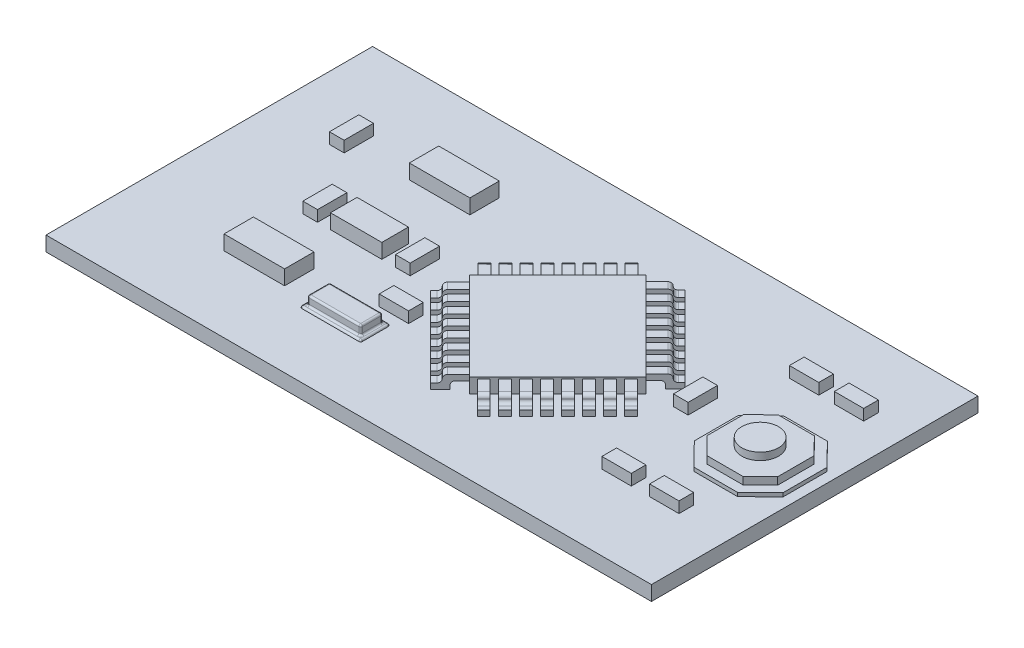
from build123d import *

# Parameters (mm, degrees)
BOARD_DIMENSIONS_W     = 33
BOARD_DIMENSIONS_H     = 17.8
BOARD_DEPTH            = 0.8
COMPONENTS1_W          = 3.3
COMPONENTS1_H          = 1.6
COMPONENTS1_W_2        = 2.8
COMPONENTS1_H_2        = 1.45
LARGE_COMPONENTS_DEPTH = 0.8
SKETCH7_W              = 0.8
SKETCH7_H              = 1.6
SKETCH7_W_2            = 1.6
SKETCH7_H_2            = 0.8
SMALL_COMPONENTS_DEPTH = 0.6
SKETCH8_W              = 3.3
SKETCH8_H              = 1.6
CRYSTAL_BOTTOM_DEPTH   = 0.1
SKETCH9_W              = 2.9
SKETCH9_H              = 1.2
CRYSTAL_TOP_DEPTH      = 0.5
FILLET_2_R             = 0.1
ATMEL_DEPTH            = 0.8
BOSS_EXTRUDE8_DEPTH    = 0.5
FILLET7_R              = 0.2
LPATTERN4_COUNT        = 8
LPATTERN4_PITCH        = 0.81
FILLET7_OF_LPATTERN4_R = 0.2
MIRROR8_START          = 4.131544437
MIRROR8_DEPTH          = 0.5
MIRROR8_START_2        = 4.941544437
MIRROR8_2_DEPTH        = 0.5
MIRROR8_START_3        = 5.751544437
MIRROR8_3_DEPTH        = 0.5
MIRROR8_START_4        = 6.561544437
MIRROR8_4_DEPTH        = 0.5
MIRROR8_START_5        = 7.371544437
MIRROR8_5_DEPTH        = 0.5
MIRROR8_START_6        = 8.181544437
MIRROR8_6_DEPTH        = 0.5
MIRROR8_START_7        = 8.991544437
MIRROR8_7_DEPTH        = 0.5
MIRROR8_START_8        = 9.801544437
MIRROR8_8_DEPTH        = 0.5
BOSS_EXTRUDE9_START    = 16.65192446
BOSS_EXTRUDE9_DEPTH    = 0.5
BOSS_EXTRUDE9_START_2  = 17.46192446
BOSS_EXTRUDE9_2_DEPTH  = 0.5
BOSS_EXTRUDE9_START_3  = 18.27192446
BOSS_EXTRUDE9_3_DEPTH  = 0.5
BOSS_EXTRUDE9_START_4  = 19.08192446
BOSS_EXTRUDE9_4_DEPTH  = 0.5
BOSS_EXTRUDE9_START_5  = 19.89192446
BOSS_EXTRUDE9_5_DEPTH  = 0.5
BOSS_EXTRUDE9_START_6  = 20.70192446
BOSS_EXTRUDE9_6_DEPTH  = 0.5
BOSS_EXTRUDE9_START_7  = 21.51192446
BOSS_EXTRUDE9_7_DEPTH  = 0.5
BOSS_EXTRUDE9_START_8  = 22.32192446
BOSS_EXTRUDE9_8_DEPTH  = 0.5
BOSS_EXTRUDE9_START_9  = 4.101544437
BOSS_EXTRUDE9_9_DEPTH  = 0.5
BOSS_EXTRUDE9_START_10 = 4.911544437
BOSS_EXTRUDE9_10_DEPTH = 0.5
BOSS_EXTRUDE9_START_11 = 5.721544437
BOSS_EXTRUDE9_11_DEPTH = 0.5
BOSS_EXTRUDE9_START_12 = 6.531544437
BOSS_EXTRUDE9_12_DEPTH = 0.5
BOSS_EXTRUDE9_START_13 = 7.341544437
BOSS_EXTRUDE9_13_DEPTH = 0.5
BOSS_EXTRUDE9_START_14 = 8.151544437
BOSS_EXTRUDE9_14_DEPTH = 0.5
BOSS_EXTRUDE9_START_15 = 8.961544437
BOSS_EXTRUDE9_15_DEPTH = 0.5
BOSS_EXTRUDE9_START_16 = 9.771544437
BOSS_EXTRUDE9_16_DEPTH = 0.5
BOSS_EXTRUDE9_START_17 = 0.8
BOSS_EXTRUDE9_17_DEPTH = 0.2
BOSS_EXTRUDE10_DEPTH   = 0.4
SKETCH24_R             = 1
BOSS_EXTRUDE11_DEPTH   = 0.4


# Read off the part's stored shape, not the designer's step: Mirror8, Boss-Extrude9
with BuildPart() as part:
    # Board_dimensions → Board (new body)
    with BuildSketch(Plane(origin=(0, 0, 0), x_dir=(1, 0, 0), z_dir=(0, 1, 0))):
        with Locations((16.5, 8.9)):
            Rectangle(BOARD_DIMENSIONS_W, BOARD_DIMENSIONS_H)
    extrude(amount=BOARD_DEPTH)

    # Components1 → Large Components (add)
    with BuildSketch(Plane(origin=(0, 0.8, 0), x_dir=(1, 0, 0), z_dir=(0, 1, 0))):
        with Locations((8.95, 13.304486799)):
            Rectangle(COMPONENTS1_W, COMPONENTS1_H)
        with Locations((7.25, 4.904486799)):
            Rectangle(COMPONENTS1_W, COMPONENTS1_H)
        with Locations((8.9, 8.729486799)):
            Rectangle(COMPONENTS1_W_2, COMPONENTS1_H_2)
    extrude(amount=LARGE_COMPONENTS_DEPTH)

    # Sketch7 → Small Components (add)
    with BuildSketch(Plane(origin=(0, 0.8, 0), x_dir=(1, 0, 0), z_dir=(0, 1, 0))):
        with Locations((6.4, 8.8)):
            Rectangle(SKETCH7_W, SKETCH7_H)
        with Locations((11.45, 8.8)):
            Rectangle(SKETCH7_W, SKETCH7_H)
        with Locations((13.261761712, 6.1)):
            Rectangle(SKETCH7_W_2, SKETCH7_H_2)
        with Locations((27, 4.5)):
            Rectangle(SKETCH7_W_2, SKETCH7_H_2)
        with Locations((3.85, 12.8)):
            Rectangle(SKETCH7_W, SKETCH7_H)
        with Locations((29.6, 4.5)):
            Rectangle(SKETCH7_W_2, SKETCH7_H_2)
        with Locations((27.8201209, 13.9)):
            Rectangle(SKETCH7_W_2, SKETCH7_H_2)
        with Locations((30.2701209, 13.9)):
            Rectangle(SKETCH7_W_2, SKETCH7_H_2)
        with Locations((25.6, 9.8)):
            Rectangle(SKETCH7_W, SKETCH7_H)
    extrude(amount=SMALL_COMPONENTS_DEPTH)

    # Sketch8 → Crystal_bottom (add)
    with BuildSketch(Plane(origin=(0, 0.8, 0), x_dir=(1, 0, 0), z_dir=(0, 1, 0))):
        with Locations((12, 4.3)):
            Rectangle(SKETCH8_W, SKETCH8_H)
    extrude(amount=CRYSTAL_BOTTOM_DEPTH)

    # Sketch9 → Crystal_top (add)
    with BuildSketch(Plane(origin=(0, 0.9, 0), x_dir=(1, 0, 0), z_dir=(0, 1, 0))):
        with Locations((12, 4.3)):
            Rectangle(SKETCH9_W, SKETCH9_H)
    extrude(amount=CRYSTAL_TOP_DEPTH)

    # Fillet 2
    fillet_2_edges = [part.edges().sort_by_distance(p)[0] for p in [
        (10.35, 0.85, -5.1),
        (10.35, 0.85, -3.5),
        (13.65, 0.85, -3.5),
        (13.65, 0.85, -5.1),
        (10.35, 0.9, -4.3),
        (12, 0.9, -3.5),
        (13.65, 0.9, -4.3),
        (12, 0.9, -5.1),
        (10.55, 0.9, -4.3),
        (10.55, 1.15, -4.9),
        (12, 0.9, -3.7),
        (10.55, 1.15, -3.7),
        (13.45, 0.9, -4.3),
        (13.45, 1.15, -3.7),
        (12, 0.9, -4.9),
        (13.45, 1.15, -4.9),
        (10.55, 1.4, -4.3),
        (12, 1.4, -3.7),
        (13.45, 1.4, -4.3),
        (12, 1.4, -4.9),
    ]]
    fillet(fillet_2_edges, radius=FILLET_2_R - 0.0001)  # a hair under: the kernel refuses the full size

    # Sketch10 → Atmel (add)
    with BuildSketch(Plane(origin=(0, 0.8, 0), x_dir=(1, 0, 0), z_dir=(0, 1, 0))):
        Polygon((19.03776743, 13.66157173), (23.846093542, 8.853245618), (19.03776743, 4.044919506), (14.229441318, 8.853245618), align=None)
    extrude(amount=ATMEL_DEPTH)

    # Sketch13 → Boss-Extrude8 (add)
    with BuildSketch(Plane(origin=(11.753475502, 0, -11.753475502), x_dir=(0.707106781186544, 0, 0.7071067811865511), z_dir=(-0.7071067811865511, 0, 0.707106781186544))):
        Polygon((11.651544437, 1.5), (10.601544437, 1.5), (10.601544437, 1.2), (11.351544437, 1.2), (11.351544437, 0.8), (12.101544437, 0.8), (12.101544437, 1.1), (11.651544437, 1.1), align=None)
    boss_extrude8 = extrude(amount=-BOSS_EXTRUDE8_DEPTH)

    # Fillet7
    fillet7_edges = [part.edges().sort_by_distance(p)[0] for p in [
        (19.957006246, 1.2, -3.903498149),
        (20.16913828, 1.1, -3.691366115),
        (20.16913828, 1.5, -3.691366115),
    ]]
    fillet(fillet7_edges, radius=FILLET7_R - 0.0001)  # a hair under: the kernel refuses the full size

    # LPattern4: Boss-Extrude8 ×8
    with Locations(*[Vector(0.7071067811865515, 0, -0.7071067811865437) * (i * LPATTERN4_PITCH) for i in range(1, LPATTERN4_COUNT)]):
        add(boss_extrude8)

    # Fillet7 of LPattern4
    fillet7_of_lpattern4_edges = [part.edges().sort_by_distance(p)[0] for p in [
        (20.529762739, 1.2, -4.476254642),
        (20.741894773, 1.1, -4.264122608),
        (20.741894773, 1.5, -4.264122608),
        (21.102519231, 1.2, -5.049011135),
        (21.314651266, 1.1, -4.8368791),
        (21.314651266, 1.5, -4.8368791),
        (21.675275724, 1.2, -5.621767628),
        (21.887407759, 1.1, -5.409635593),
        (21.887407759, 1.5, -5.409635593),
        (22.248032217, 1.2, -6.19452412),
        (22.460164251, 1.1, -5.982392086),
        (22.460164251, 1.5, -5.982392086),
        (22.82078871, 1.2, -6.767280613),
        (23.032920744, 1.1, -6.555148579),
        (23.032920744, 1.5, -6.555148579),
        (23.393545203, 1.2, -7.340037106),
        (23.605677237, 1.1, -7.127905071),
        (23.605677237, 1.5, -7.127905071),
        (23.966301695, 1.2, -7.912793599),
        (24.17843373, 1.1, -7.700661564),
        (24.17843373, 1.5, -7.700661564),
    ]]
    fillet(fillet7_of_lpattern4_edges, radius=FILLET7_OF_LPATTERN4_R - 0.0001)  # a hair under: the kernel refuses the full size

    # Mirror8 outline → Mirror8 (add)
    with BuildSketch(Plane(origin=(0, 0, 0), x_dir=(0.7071067811865509, 0, -0.707106781186544), z_dir=(0.707106781186544, 0, 0.707106781186551)).offset(MIRROR8_START)):
        with BuildLine():
            Line((16.32192446, 1.5), (15.47192446, 1.5))
            ThreePointArc((15.47192446, 1.5), (15.330503104, 1.441421356), (15.27192446, 1.3))
            ThreePointArc((15.27192446, 1.3), (15.213345817, 1.158578643), (15.07192446, 1.1))
            Line((15.07192446, 1.1), (14.82192446, 1.1))
            Line((14.82192446, 1.1), (14.82192446, 0.8))
            Line((14.82192446, 0.8), (15.57192446, 0.8))
            Line((15.57192446, 0.8), (15.57192446, 1))
            ThreePointArc((15.57192446, 1), (15.630503104, 1.141421356), (15.77192446, 1.2))
            Line((15.77192446, 1.2), (16.32192446, 1.2))
            Line((16.32192446, 1.2), (16.32192446, 1.5))
        make_face()
    extrude(amount=MIRROR8_DEPTH)

    # Mirror8 2 outline → Mirror8 2 (add)
    with BuildSketch(Plane(origin=(0, 0, 0), x_dir=(0.7071067811865509, 0, -0.707106781186544), z_dir=(0.707106781186544, 0, 0.707106781186551)).offset(MIRROR8_START_2)):
        with BuildLine():
            Line((16.32192446, 1.5), (15.47192446, 1.5))
            ThreePointArc((15.47192446, 1.5), (15.330503104, 1.441421356), (15.27192446, 1.3))
            ThreePointArc((15.27192446, 1.3), (15.213345817, 1.158578643), (15.07192446, 1.1))
            Line((15.07192446, 1.1), (14.82192446, 1.1))
            Line((14.82192446, 1.1), (14.82192446, 0.8))
            Line((14.82192446, 0.8), (15.57192446, 0.8))
            Line((15.57192446, 0.8), (15.57192446, 1))
            ThreePointArc((15.57192446, 1), (15.630503104, 1.141421356), (15.77192446, 1.2))
            Line((15.77192446, 1.2), (16.32192446, 1.2))
            Line((16.32192446, 1.2), (16.32192446, 1.5))
        make_face()
    extrude(amount=MIRROR8_2_DEPTH)

    # Mirror8 3 outline → Mirror8 3 (add)
    with BuildSketch(Plane(origin=(0, 0, 0), x_dir=(0.7071067811865509, 0, -0.707106781186544), z_dir=(0.707106781186544, 0, 0.707106781186551)).offset(MIRROR8_START_3)):
        with BuildLine():
            Line((16.32192446, 1.5), (15.47192446, 1.5))
            ThreePointArc((15.47192446, 1.5), (15.330503104, 1.441421356), (15.27192446, 1.3))
            ThreePointArc((15.27192446, 1.3), (15.213345817, 1.158578643), (15.07192446, 1.1))
            Line((15.07192446, 1.1), (14.82192446, 1.1))
            Line((14.82192446, 1.1), (14.82192446, 0.8))
            Line((14.82192446, 0.8), (15.57192446, 0.8))
            Line((15.57192446, 0.8), (15.57192446, 1))
            ThreePointArc((15.57192446, 1), (15.630503104, 1.141421356), (15.77192446, 1.2))
            Line((15.77192446, 1.2), (16.32192446, 1.2))
            Line((16.32192446, 1.2), (16.32192446, 1.5))
        make_face()
    extrude(amount=MIRROR8_3_DEPTH)

    # Mirror8 4 outline → Mirror8 4 (add)
    with BuildSketch(Plane(origin=(0, 0, 0), x_dir=(0.7071067811865509, 0, -0.707106781186544), z_dir=(0.707106781186544, 0, 0.707106781186551)).offset(MIRROR8_START_4)):
        with BuildLine():
            Line((16.32192446, 1.5), (15.47192446, 1.5))
            ThreePointArc((15.47192446, 1.5), (15.330503104, 1.441421356), (15.27192446, 1.3))
            ThreePointArc((15.27192446, 1.3), (15.213345817, 1.158578643), (15.07192446, 1.1))
            Line((15.07192446, 1.1), (14.82192446, 1.1))
            Line((14.82192446, 1.1), (14.82192446, 0.8))
            Line((14.82192446, 0.8), (15.57192446, 0.8))
            Line((15.57192446, 0.8), (15.57192446, 1))
            ThreePointArc((15.57192446, 1), (15.630503104, 1.141421356), (15.77192446, 1.2))
            Line((15.77192446, 1.2), (16.32192446, 1.2))
            Line((16.32192446, 1.2), (16.32192446, 1.5))
        make_face()
    extrude(amount=MIRROR8_4_DEPTH)

    # Mirror8 5 outline → Mirror8 5 (add)
    with BuildSketch(Plane(origin=(0, 0, 0), x_dir=(0.7071067811865509, 0, -0.707106781186544), z_dir=(0.707106781186544, 0, 0.707106781186551)).offset(MIRROR8_START_5)):
        with BuildLine():
            Line((16.32192446, 1.5), (15.47192446, 1.5))
            ThreePointArc((15.47192446, 1.5), (15.330503104, 1.441421356), (15.27192446, 1.3))
            ThreePointArc((15.27192446, 1.3), (15.213345817, 1.158578643), (15.07192446, 1.1))
            Line((15.07192446, 1.1), (14.82192446, 1.1))
            Line((14.82192446, 1.1), (14.82192446, 0.8))
            Line((14.82192446, 0.8), (15.57192446, 0.8))
            Line((15.57192446, 0.8), (15.57192446, 1))
            ThreePointArc((15.57192446, 1), (15.630503104, 1.141421356), (15.77192446, 1.2))
            Line((15.77192446, 1.2), (16.32192446, 1.2))
            Line((16.32192446, 1.2), (16.32192446, 1.5))
        make_face()
    extrude(amount=MIRROR8_5_DEPTH)

    # Mirror8 6 outline → Mirror8 6 (add)
    with BuildSketch(Plane(origin=(0, 0, 0), x_dir=(0.7071067811865509, 0, -0.707106781186544), z_dir=(0.707106781186544, 0, 0.707106781186551)).offset(MIRROR8_START_6)):
        with BuildLine():
            Line((16.32192446, 1.5), (15.47192446, 1.5))
            ThreePointArc((15.47192446, 1.5), (15.330503104, 1.441421356), (15.27192446, 1.3))
            ThreePointArc((15.27192446, 1.3), (15.213345817, 1.158578643), (15.07192446, 1.1))
            Line((15.07192446, 1.1), (14.82192446, 1.1))
            Line((14.82192446, 1.1), (14.82192446, 0.8))
            Line((14.82192446, 0.8), (15.57192446, 0.8))
            Line((15.57192446, 0.8), (15.57192446, 1))
            ThreePointArc((15.57192446, 1), (15.630503104, 1.141421356), (15.77192446, 1.2))
            Line((15.77192446, 1.2), (16.32192446, 1.2))
            Line((16.32192446, 1.2), (16.32192446, 1.5))
        make_face()
    extrude(amount=MIRROR8_6_DEPTH)

    # Mirror8 7 outline → Mirror8 7 (add)
    with BuildSketch(Plane(origin=(0, 0, 0), x_dir=(0.7071067811865509, 0, -0.707106781186544), z_dir=(0.707106781186544, 0, 0.707106781186551)).offset(MIRROR8_START_7)):
        with BuildLine():
            Line((16.32192446, 1.5), (15.47192446, 1.5))
            ThreePointArc((15.47192446, 1.5), (15.330503104, 1.441421356), (15.27192446, 1.3))
            ThreePointArc((15.27192446, 1.3), (15.213345817, 1.158578643), (15.07192446, 1.1))
            Line((15.07192446, 1.1), (14.82192446, 1.1))
            Line((14.82192446, 1.1), (14.82192446, 0.8))
            Line((14.82192446, 0.8), (15.57192446, 0.8))
            Line((15.57192446, 0.8), (15.57192446, 1))
            ThreePointArc((15.57192446, 1), (15.630503104, 1.141421356), (15.77192446, 1.2))
            Line((15.77192446, 1.2), (16.32192446, 1.2))
            Line((16.32192446, 1.2), (16.32192446, 1.5))
        make_face()
    extrude(amount=MIRROR8_7_DEPTH)

    # Mirror8 8 outline → Mirror8 8 (add)
    with BuildSketch(Plane(origin=(0, 0, 0), x_dir=(0.7071067811865509, 0, -0.707106781186544), z_dir=(0.707106781186544, 0, 0.707106781186551)).offset(MIRROR8_START_8)):
        with BuildLine():
            Line((16.32192446, 1.5), (15.47192446, 1.5))
            ThreePointArc((15.47192446, 1.5), (15.330503104, 1.441421356), (15.27192446, 1.3))
            ThreePointArc((15.27192446, 1.3), (15.213345817, 1.158578643), (15.07192446, 1.1))
            Line((15.07192446, 1.1), (14.82192446, 1.1))
            Line((14.82192446, 1.1), (14.82192446, 0.8))
            Line((14.82192446, 0.8), (15.57192446, 0.8))
            Line((15.57192446, 0.8), (15.57192446, 1))
            ThreePointArc((15.57192446, 1), (15.630503104, 1.141421356), (15.77192446, 1.2))
            Line((15.77192446, 1.2), (16.32192446, 1.2))
            Line((16.32192446, 1.2), (16.32192446, 1.5))
        make_face()
    extrude(amount=MIRROR8_8_DEPTH)

    # Boss-Extrude9 outline → Boss-Extrude9 (add)
    with BuildSketch(Plane(origin=(0, 0, 0), x_dir=(0.7071067811865438, 0, 0.7071067811865512), z_dir=(0.7071067811865511, 0, -0.7071067811865441)).offset(BOSS_EXTRUDE9_START)):
        with BuildLine():
            ThreePointArc((2.751544437, -1.3), (2.810123081, -1.441421356), (2.951544437, -1.5))
            Line((2.951544437, -1.5), (3.801544437, -1.5))
            Line((3.801544437, -1.5), (3.801544437, -1.2))
            Line((3.801544437, -1.2), (3.251544437, -1.2))
            ThreePointArc((3.251544437, -1.2), (3.110123081, -1.141421356), (3.051544437, -1))
            Line((3.051544437, -1), (3.051544437, -0.8))
            Line((3.051544437, -0.8), (2.301544437, -0.8))
            Line((2.301544437, -0.8), (2.301544437, -1.1))
            Line((2.301544437, -1.1), (2.551544437, -1.1))
            ThreePointArc((2.551544437, -1.1), (2.692965793, -1.158578644), (2.751544437, -1.3))
        make_face()
    extrude(amount=BOSS_EXTRUDE9_DEPTH)

    # Boss-Extrude9 2 outline → Boss-Extrude9 2 (add)
    with BuildSketch(Plane(origin=(0, 0, 0), x_dir=(0.7071067811865438, 0, 0.7071067811865512), z_dir=(0.7071067811865511, 0, -0.7071067811865441)).offset(BOSS_EXTRUDE9_START_2)):
        with BuildLine():
            ThreePointArc((2.751544437, -1.3), (2.810123081, -1.441421356), (2.951544437, -1.5))
            Line((2.951544437, -1.5), (3.801544437, -1.5))
            Line((3.801544437, -1.5), (3.801544437, -1.2))
            Line((3.801544437, -1.2), (3.251544437, -1.2))
            ThreePointArc((3.251544437, -1.2), (3.110123081, -1.141421356), (3.051544437, -1))
            Line((3.051544437, -1), (3.051544437, -0.8))
            Line((3.051544437, -0.8), (2.301544437, -0.8))
            Line((2.301544437, -0.8), (2.301544437, -1.1))
            Line((2.301544437, -1.1), (2.551544437, -1.1))
            ThreePointArc((2.551544437, -1.1), (2.692965793, -1.158578644), (2.751544437, -1.3))
        make_face()
    extrude(amount=BOSS_EXTRUDE9_2_DEPTH)

    # Boss-Extrude9 3 outline → Boss-Extrude9 3 (add)
    with BuildSketch(Plane(origin=(0, 0, 0), x_dir=(0.7071067811865438, 0, 0.7071067811865512), z_dir=(0.7071067811865511, 0, -0.7071067811865441)).offset(BOSS_EXTRUDE9_START_3)):
        with BuildLine():
            ThreePointArc((2.751544437, -1.3), (2.810123081, -1.441421356), (2.951544437, -1.5))
            Line((2.951544437, -1.5), (3.801544437, -1.5))
            Line((3.801544437, -1.5), (3.801544437, -1.2))
            Line((3.801544437, -1.2), (3.251544437, -1.2))
            ThreePointArc((3.251544437, -1.2), (3.110123081, -1.141421356), (3.051544437, -1))
            Line((3.051544437, -1), (3.051544437, -0.8))
            Line((3.051544437, -0.8), (2.301544437, -0.8))
            Line((2.301544437, -0.8), (2.301544437, -1.1))
            Line((2.301544437, -1.1), (2.551544437, -1.1))
            ThreePointArc((2.551544437, -1.1), (2.692965793, -1.158578644), (2.751544437, -1.3))
        make_face()
    extrude(amount=BOSS_EXTRUDE9_3_DEPTH)

    # Boss-Extrude9 4 outline → Boss-Extrude9 4 (add)
    with BuildSketch(Plane(origin=(0, 0, 0), x_dir=(0.7071067811865438, 0, 0.7071067811865512), z_dir=(0.7071067811865511, 0, -0.7071067811865441)).offset(BOSS_EXTRUDE9_START_4)):
        with BuildLine():
            ThreePointArc((2.751544437, -1.3), (2.810123081, -1.441421356), (2.951544437, -1.5))
            Line((2.951544437, -1.5), (3.801544437, -1.5))
            Line((3.801544437, -1.5), (3.801544437, -1.2))
            Line((3.801544437, -1.2), (3.251544437, -1.2))
            ThreePointArc((3.251544437, -1.2), (3.110123081, -1.141421356), (3.051544437, -1))
            Line((3.051544437, -1), (3.051544437, -0.8))
            Line((3.051544437, -0.8), (2.301544437, -0.8))
            Line((2.301544437, -0.8), (2.301544437, -1.1))
            Line((2.301544437, -1.1), (2.551544437, -1.1))
            ThreePointArc((2.551544437, -1.1), (2.692965793, -1.158578644), (2.751544437, -1.3))
        make_face()
    extrude(amount=BOSS_EXTRUDE9_4_DEPTH)

    # Boss-Extrude9 5 outline → Boss-Extrude9 5 (add)
    with BuildSketch(Plane(origin=(0, 0, 0), x_dir=(0.7071067811865438, 0, 0.7071067811865512), z_dir=(0.7071067811865511, 0, -0.7071067811865441)).offset(BOSS_EXTRUDE9_START_5)):
        with BuildLine():
            ThreePointArc((2.751544437, -1.3), (2.810123081, -1.441421356), (2.951544437, -1.5))
            Line((2.951544437, -1.5), (3.801544437, -1.5))
            Line((3.801544437, -1.5), (3.801544437, -1.2))
            Line((3.801544437, -1.2), (3.251544437, -1.2))
            ThreePointArc((3.251544437, -1.2), (3.110123081, -1.141421356), (3.051544437, -1))
            Line((3.051544437, -1), (3.051544437, -0.8))
            Line((3.051544437, -0.8), (2.301544437, -0.8))
            Line((2.301544437, -0.8), (2.301544437, -1.1))
            Line((2.301544437, -1.1), (2.551544437, -1.1))
            ThreePointArc((2.551544437, -1.1), (2.692965793, -1.158578644), (2.751544437, -1.3))
        make_face()
    extrude(amount=BOSS_EXTRUDE9_5_DEPTH)

    # Boss-Extrude9 6 outline → Boss-Extrude9 6 (add)
    with BuildSketch(Plane(origin=(0, 0, 0), x_dir=(0.7071067811865438, 0, 0.7071067811865512), z_dir=(0.7071067811865511, 0, -0.7071067811865441)).offset(BOSS_EXTRUDE9_START_6)):
        with BuildLine():
            ThreePointArc((2.751544437, -1.3), (2.810123081, -1.441421356), (2.951544437, -1.5))
            Line((2.951544437, -1.5), (3.801544437, -1.5))
            Line((3.801544437, -1.5), (3.801544437, -1.2))
            Line((3.801544437, -1.2), (3.251544437, -1.2))
            ThreePointArc((3.251544437, -1.2), (3.110123081, -1.141421356), (3.051544437, -1))
            Line((3.051544437, -1), (3.051544437, -0.8))
            Line((3.051544437, -0.8), (2.301544437, -0.8))
            Line((2.301544437, -0.8), (2.301544437, -1.1))
            Line((2.301544437, -1.1), (2.551544437, -1.1))
            ThreePointArc((2.551544437, -1.1), (2.692965793, -1.158578644), (2.751544437, -1.3))
        make_face()
    extrude(amount=BOSS_EXTRUDE9_6_DEPTH)

    # Boss-Extrude9 7 outline → Boss-Extrude9 7 (add)
    with BuildSketch(Plane(origin=(0, 0, 0), x_dir=(0.7071067811865438, 0, 0.7071067811865512), z_dir=(0.7071067811865511, 0, -0.7071067811865441)).offset(BOSS_EXTRUDE9_START_7)):
        with BuildLine():
            ThreePointArc((2.751544437, -1.3), (2.810123081, -1.441421356), (2.951544437, -1.5))
            Line((2.951544437, -1.5), (3.801544437, -1.5))
            Line((3.801544437, -1.5), (3.801544437, -1.2))
            Line((3.801544437, -1.2), (3.251544437, -1.2))
            ThreePointArc((3.251544437, -1.2), (3.110123081, -1.141421356), (3.051544437, -1))
            Line((3.051544437, -1), (3.051544437, -0.8))
            Line((3.051544437, -0.8), (2.301544437, -0.8))
            Line((2.301544437, -0.8), (2.301544437, -1.1))
            Line((2.301544437, -1.1), (2.551544437, -1.1))
            ThreePointArc((2.551544437, -1.1), (2.692965793, -1.158578644), (2.751544437, -1.3))
        make_face()
    extrude(amount=BOSS_EXTRUDE9_7_DEPTH)

    # Boss-Extrude9 8 outline → Boss-Extrude9 8 (add)
    with BuildSketch(Plane(origin=(0, 0, 0), x_dir=(0.7071067811865438, 0, 0.7071067811865512), z_dir=(0.7071067811865511, 0, -0.7071067811865441)).offset(BOSS_EXTRUDE9_START_8)):
        with BuildLine():
            ThreePointArc((2.751544437, -1.3), (2.810123081, -1.441421356), (2.951544437, -1.5))
            Line((2.951544437, -1.5), (3.801544437, -1.5))
            Line((3.801544437, -1.5), (3.801544437, -1.2))
            Line((3.801544437, -1.2), (3.251544437, -1.2))
            ThreePointArc((3.251544437, -1.2), (3.110123081, -1.141421356), (3.051544437, -1))
            Line((3.051544437, -1), (3.051544437, -0.8))
            Line((3.051544437, -0.8), (2.301544437, -0.8))
            Line((2.301544437, -0.8), (2.301544437, -1.1))
            Line((2.301544437, -1.1), (2.551544437, -1.1))
            ThreePointArc((2.551544437, -1.1), (2.692965793, -1.158578644), (2.751544437, -1.3))
        make_face()
    extrude(amount=BOSS_EXTRUDE9_8_DEPTH)

    # Boss-Extrude9 9 outline → Boss-Extrude9 9 (add)
    with BuildSketch(Plane(origin=(0, 0, 0), x_dir=(0.7071067811865509, 0, -0.707106781186544), z_dir=(0.707106781186544, 0, 0.707106781186551)).offset(BOSS_EXTRUDE9_START_9)):
        with BuildLine():
            Line((23.97192446, 1.5), (23.12192446, 1.5))
            Line((23.12192446, 1.5), (23.12192446, 1.2))
            Line((23.12192446, 1.2), (23.67192446, 1.2))
            ThreePointArc((23.67192446, 1.2), (23.813345817, 1.141421356), (23.87192446, 1))
            Line((23.87192446, 1), (23.87192446, 0.8))
            Line((23.87192446, 0.8), (24.62192446, 0.8))
            Line((24.62192446, 0.8), (24.62192446, 1.1))
            Line((24.62192446, 1.1), (24.37192446, 1.1))
            ThreePointArc((24.37192446, 1.1), (24.230503104, 1.158578644), (24.17192446, 1.3))
            ThreePointArc((24.17192446, 1.3), (24.113345817, 1.441421356), (23.97192446, 1.5))
        make_face()
    extrude(amount=BOSS_EXTRUDE9_9_DEPTH)

    # Boss-Extrude9 10 outline → Boss-Extrude9 10 (add)
    with BuildSketch(Plane(origin=(0, 0, 0), x_dir=(0.7071067811865509, 0, -0.707106781186544), z_dir=(0.707106781186544, 0, 0.707106781186551)).offset(BOSS_EXTRUDE9_START_10)):
        with BuildLine():
            Line((23.97192446, 1.5), (23.12192446, 1.5))
            Line((23.12192446, 1.5), (23.12192446, 1.2))
            Line((23.12192446, 1.2), (23.67192446, 1.2))
            ThreePointArc((23.67192446, 1.2), (23.813345817, 1.141421356), (23.87192446, 1))
            Line((23.87192446, 1), (23.87192446, 0.8))
            Line((23.87192446, 0.8), (24.62192446, 0.8))
            Line((24.62192446, 0.8), (24.62192446, 1.1))
            Line((24.62192446, 1.1), (24.37192446, 1.1))
            ThreePointArc((24.37192446, 1.1), (24.230503104, 1.158578644), (24.17192446, 1.3))
            ThreePointArc((24.17192446, 1.3), (24.113345817, 1.441421356), (23.97192446, 1.5))
        make_face()
    extrude(amount=BOSS_EXTRUDE9_10_DEPTH)

    # Boss-Extrude9 11 outline → Boss-Extrude9 11 (add)
    with BuildSketch(Plane(origin=(0, 0, 0), x_dir=(0.7071067811865509, 0, -0.707106781186544), z_dir=(0.707106781186544, 0, 0.707106781186551)).offset(BOSS_EXTRUDE9_START_11)):
        with BuildLine():
            Line((23.97192446, 1.5), (23.12192446, 1.5))
            Line((23.12192446, 1.5), (23.12192446, 1.2))
            Line((23.12192446, 1.2), (23.67192446, 1.2))
            ThreePointArc((23.67192446, 1.2), (23.813345817, 1.141421356), (23.87192446, 1))
            Line((23.87192446, 1), (23.87192446, 0.8))
            Line((23.87192446, 0.8), (24.62192446, 0.8))
            Line((24.62192446, 0.8), (24.62192446, 1.1))
            Line((24.62192446, 1.1), (24.37192446, 1.1))
            ThreePointArc((24.37192446, 1.1), (24.230503104, 1.158578644), (24.17192446, 1.3))
            ThreePointArc((24.17192446, 1.3), (24.113345817, 1.441421356), (23.97192446, 1.5))
        make_face()
    extrude(amount=BOSS_EXTRUDE9_11_DEPTH)

    # Boss-Extrude9 12 outline → Boss-Extrude9 12 (add)
    with BuildSketch(Plane(origin=(0, 0, 0), x_dir=(0.7071067811865509, 0, -0.707106781186544), z_dir=(0.707106781186544, 0, 0.707106781186551)).offset(BOSS_EXTRUDE9_START_12)):
        with BuildLine():
            Line((23.97192446, 1.5), (23.12192446, 1.5))
            Line((23.12192446, 1.5), (23.12192446, 1.2))
            Line((23.12192446, 1.2), (23.67192446, 1.2))
            ThreePointArc((23.67192446, 1.2), (23.813345817, 1.141421356), (23.87192446, 1))
            Line((23.87192446, 1), (23.87192446, 0.8))
            Line((23.87192446, 0.8), (24.62192446, 0.8))
            Line((24.62192446, 0.8), (24.62192446, 1.1))
            Line((24.62192446, 1.1), (24.37192446, 1.1))
            ThreePointArc((24.37192446, 1.1), (24.230503104, 1.158578644), (24.17192446, 1.3))
            ThreePointArc((24.17192446, 1.3), (24.113345817, 1.441421356), (23.97192446, 1.5))
        make_face()
    extrude(amount=BOSS_EXTRUDE9_12_DEPTH)

    # Boss-Extrude9 13 outline → Boss-Extrude9 13 (add)
    with BuildSketch(Plane(origin=(0, 0, 0), x_dir=(0.7071067811865509, 0, -0.707106781186544), z_dir=(0.707106781186544, 0, 0.707106781186551)).offset(BOSS_EXTRUDE9_START_13)):
        with BuildLine():
            Line((23.97192446, 1.5), (23.12192446, 1.5))
            Line((23.12192446, 1.5), (23.12192446, 1.2))
            Line((23.12192446, 1.2), (23.67192446, 1.2))
            ThreePointArc((23.67192446, 1.2), (23.813345817, 1.141421356), (23.87192446, 1))
            Line((23.87192446, 1), (23.87192446, 0.8))
            Line((23.87192446, 0.8), (24.62192446, 0.8))
            Line((24.62192446, 0.8), (24.62192446, 1.1))
            Line((24.62192446, 1.1), (24.37192446, 1.1))
            ThreePointArc((24.37192446, 1.1), (24.230503104, 1.158578644), (24.17192446, 1.3))
            ThreePointArc((24.17192446, 1.3), (24.113345817, 1.441421356), (23.97192446, 1.5))
        make_face()
    extrude(amount=BOSS_EXTRUDE9_13_DEPTH)

    # Boss-Extrude9 14 outline → Boss-Extrude9 14 (add)
    with BuildSketch(Plane(origin=(0, 0, 0), x_dir=(0.7071067811865509, 0, -0.707106781186544), z_dir=(0.707106781186544, 0, 0.707106781186551)).offset(BOSS_EXTRUDE9_START_14)):
        with BuildLine():
            Line((23.97192446, 1.5), (23.12192446, 1.5))
            Line((23.12192446, 1.5), (23.12192446, 1.2))
            Line((23.12192446, 1.2), (23.67192446, 1.2))
            ThreePointArc((23.67192446, 1.2), (23.813345817, 1.141421356), (23.87192446, 1))
            Line((23.87192446, 1), (23.87192446, 0.8))
            Line((23.87192446, 0.8), (24.62192446, 0.8))
            Line((24.62192446, 0.8), (24.62192446, 1.1))
            Line((24.62192446, 1.1), (24.37192446, 1.1))
            ThreePointArc((24.37192446, 1.1), (24.230503104, 1.158578644), (24.17192446, 1.3))
            ThreePointArc((24.17192446, 1.3), (24.113345817, 1.441421356), (23.97192446, 1.5))
        make_face()
    extrude(amount=BOSS_EXTRUDE9_14_DEPTH)

    # Boss-Extrude9 15 outline → Boss-Extrude9 15 (add)
    with BuildSketch(Plane(origin=(0, 0, 0), x_dir=(0.7071067811865509, 0, -0.707106781186544), z_dir=(0.707106781186544, 0, 0.707106781186551)).offset(BOSS_EXTRUDE9_START_15)):
        with BuildLine():
            Line((23.97192446, 1.5), (23.12192446, 1.5))
            Line((23.12192446, 1.5), (23.12192446, 1.2))
            Line((23.12192446, 1.2), (23.67192446, 1.2))
            ThreePointArc((23.67192446, 1.2), (23.813345817, 1.141421356), (23.87192446, 1))
            Line((23.87192446, 1), (23.87192446, 0.8))
            Line((23.87192446, 0.8), (24.62192446, 0.8))
            Line((24.62192446, 0.8), (24.62192446, 1.1))
            Line((24.62192446, 1.1), (24.37192446, 1.1))
            ThreePointArc((24.37192446, 1.1), (24.230503104, 1.158578644), (24.17192446, 1.3))
            ThreePointArc((24.17192446, 1.3), (24.113345817, 1.441421356), (23.97192446, 1.5))
        make_face()
    extrude(amount=BOSS_EXTRUDE9_15_DEPTH)

    # Boss-Extrude9 16 outline → Boss-Extrude9 16 (add)
    with BuildSketch(Plane(origin=(0, 0, 0), x_dir=(0.7071067811865509, 0, -0.707106781186544), z_dir=(0.707106781186544, 0, 0.707106781186551)).offset(BOSS_EXTRUDE9_START_16)):
        with BuildLine():
            Line((23.97192446, 1.5), (23.12192446, 1.5))
            Line((23.12192446, 1.5), (23.12192446, 1.2))
            Line((23.12192446, 1.2), (23.67192446, 1.2))
            ThreePointArc((23.67192446, 1.2), (23.813345817, 1.141421356), (23.87192446, 1))
            Line((23.87192446, 1), (23.87192446, 0.8))
            Line((23.87192446, 0.8), (24.62192446, 0.8))
            Line((24.62192446, 0.8), (24.62192446, 1.1))
            Line((24.62192446, 1.1), (24.37192446, 1.1))
            ThreePointArc((24.37192446, 1.1), (24.230503104, 1.158578644), (24.17192446, 1.3))
            ThreePointArc((24.17192446, 1.3), (24.113345817, 1.441421356), (23.97192446, 1.5))
        make_face()
    extrude(amount=BOSS_EXTRUDE9_16_DEPTH)

    # Boss-Extrude9 17 outline → Boss-Extrude9 17 (add)
    with BuildSketch(Plane(origin=(0, 0, 0), x_dir=(1, 0, 0), z_dir=(0, 1, 0)).offset(BOSS_EXTRUDE9_START_17)):
        Polygon((28.839172953, 11.364372299), (27.585627701, 10.143256292), (27.585627701, 7.753545252), (28.806743708, 6.5), (31.196454748, 6.5), (32.45, 7.721116006), (32.45, 10.110827047), (31.228883994, 11.364372299), align=None)
    extrude(amount=BOSS_EXTRUDE9_17_DEPTH)

    # Sketch22 → Boss-Extrude10 (add)
    with BuildSketch(Plane(origin=(0, 1, 0), x_dir=(1, 0, 0), z_dir=(0, 1, 0))):
        Polygon((28.085627701, 9.932301007), (28.085627701, 7.956824361), (29.017698993, 7), (30.993175639, 7), (31.95, 7.932071292), (31.95, 9.907547938), (31.017928708, 10.864372299), (29.042452062, 10.864372299), align=None)
    extrude(amount=BOSS_EXTRUDE10_DEPTH)

    # Sketch24 → Boss-Extrude11 (add)
    with BuildSketch(Plane(origin=(0, 1.4, 0), x_dir=(1, 0, 0), z_dir=(0, 1, 0))):
        with Locations(Location((30.005437316, 8.919809615, 0), (0, 0, 270))):
            Circle(SKETCH24_R)
    extrude(amount=BOSS_EXTRUDE11_DEPTH)


solid = part.part
